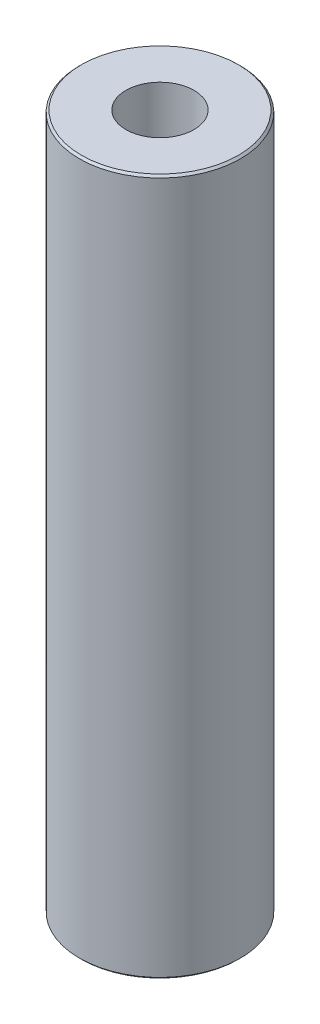
from build123d import *

# Parameters (mm, degrees)
SKETCH1_R           = 52.5
BOSS_EXTRUDE1_DEPTH = 454.009973873
SKETCH2_R           = 22.201465677
CUT_EXTRUDE1_DEPTH  = 461.040820337
CHAMFER1_SIZE       = 1.322621535


with BuildPart() as part:
    # Sketch1 → Boss-Extrude1 (new body)
    with BuildSketch(Plane(origin=(0, 0, 0), x_dir=(1, 0, 0), z_dir=(0, 1, 0))):
        Circle(SKETCH1_R)
    extrude(amount=BOSS_EXTRUDE1_DEPTH)

    # Sketch2 → Cut-Extrude1 (cut, through all)
    with BuildSketch(Plane(origin=(0, 0, 0), x_dir=(1, 0, 0), z_dir=(0, 1, 0))):
        Circle(SKETCH2_R)
    extrude(amount=CUT_EXTRUDE1_DEPTH, mode=Mode.SUBTRACT)

    # Chamfer1
    chamfer1_edges = [part.edges().sort_by_distance(p)[0] for p in [
        (-52.5, 454.009973873, 0),
        (-52.5, 0, 0),
    ]]
    chamfer(chamfer1_edges, length=CHAMFER1_SIZE)


solid = part.part
